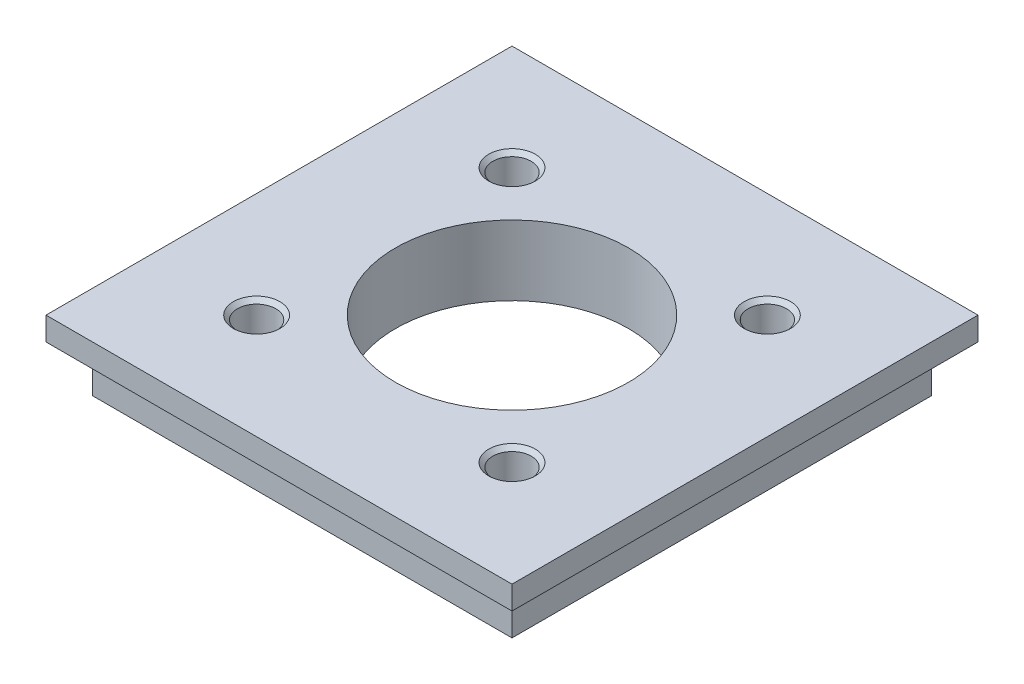
from build123d import *

# Parameters (mm, degrees)
SKETCH1_W                         = 40
SKETCH1_H                         = 40
BOSS_EXTRUDE1_DEPTH               = 2
F_25_0MM_DOWEL_HOLE1_D            = 20
SKETCH9_W                         = 36
SKETCH9_H                         = 36
SKETCH9_R                         = 10
BOSS_EXTRUDE2_DEPTH               = 4
TAP_DRILL_FOR_M4_TAP2_D           = 3.3
TAP_DRILL_FOR_M4_TAP2_CSINK_D     = 4
TAP_DRILL_FOR_M4_TAP2_CSINK_ANGLE = 90


with BuildPart() as part:
    # Sketch1 → Boss-Extrude1 (new body)
    with BuildSketch(Plane(origin=(0, 0, 0), x_dir=(1, 0, 0), z_dir=(0, 1, 0))):
        Rectangle(SKETCH1_W, SKETCH1_H)
    extrude(amount=BOSS_EXTRUDE1_DEPTH)

    # Ø25.0mm Dowel Hole1 (through all)
    with Locations(Plane(origin=(0, 0, 0), x_dir=(-1, 0, 0), z_dir=(0, -1, 0))):
        with Locations((0, 0)):
            Hole(F_25_0MM_DOWEL_HOLE1_D / 2)

    # Sketch9 → Boss-Extrude2 (add)
    with BuildSketch(Plane.XZ):
        Rectangle(SKETCH9_W, SKETCH9_H)
        Circle(SKETCH9_R, mode=Mode.SUBTRACT)
    extrude(amount=BOSS_EXTRUDE2_DEPTH)

    # Tap Drill for M4 Tap2 (through all)
    with Locations(Plane(origin=(0, 2, 0), x_dir=(1, 0, 0), z_dir=(0, 1, 0))):
        with Locations((-10.960155108, 10.960155108), (10.960155108, 10.960155108), (10.960155108, -10.960155108), (-10.960155108, -10.960155108)):
            CounterSinkHole(TAP_DRILL_FOR_M4_TAP2_D / 2, TAP_DRILL_FOR_M4_TAP2_CSINK_D / 2, counter_sink_angle=TAP_DRILL_FOR_M4_TAP2_CSINK_ANGLE)


solid = part.part
